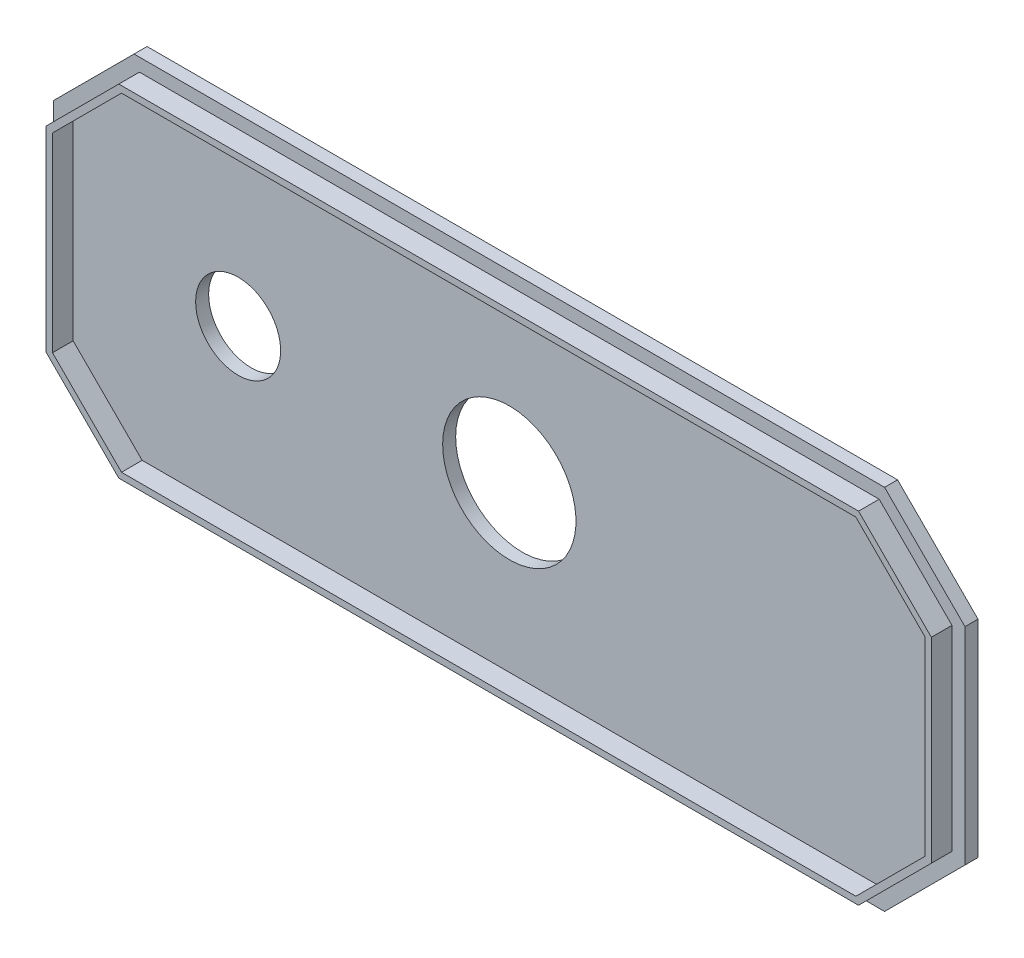
from build123d import *

# Parameters (mm, degrees)
SKETCH1_W           = 56.083
SKETCH1_H           = 22.6058
BOSS_EXTRUDE1_DEPTH = 0.8
CUT_EXTRUDE1_DEPTH  = 31.24435932
BOSS_EXTRUDE2_DEPTH = 1.27
SKETCH4_R           = 2.6162
CUT_EXTRUDE2_DEPTH  = 2.54
SKETCH5_R           = 4.1021
CUT_EXTRUDE3_DEPTH  = 2.54


with BuildPart() as part:
    # Sketch1 → Boss-Extrude1 (new body)
    with BuildSketch(Plane.XY):
        Rectangle(SKETCH1_W, SKETCH1_H)
    extrude(amount=BOSS_EXTRUDE1_DEPTH)

    # Sketch2 → Cut-Extrude1 (cut, through all)
    with BuildSketch(Plane.XY.offset(0.8)):
        Polygon((-28.0415, -6.353152532), (-23.091752532, -11.3029), (-28.0415, -11.3029), align=None)
        Polygon((-28.0415, 6.353152532), (-23.091752532, 11.3029), (-28.0415, 11.3029), align=None)
        Polygon((23.091752532, -11.3029), (28.0415, -6.353152532), (28.0415, -11.3029), align=None)
        Polygon((23.091752532, 11.3029), (28.0415, 6.353152532), (28.0415, 11.3029), align=None)
    extrude(amount=-CUT_EXTRUDE1_DEPTH, mode=Mode.SUBTRACT)

    # Sketch3 → Boss-Extrude2 (add)
    with BuildSketch(Plane.XY.offset(0.8)):
        Polygon((22.760381698, 10.502900038), (-22.760381698, 10.502900038), (-27.241500038, 6.021781698), (-27.241500038, -6.021781698), (-22.760381698, -10.502900038), (22.760381698, -10.502900038), (27.241500038, -6.021781698), (27.241500038, 6.021781698), align=None)
        Polygon((-22.594696288, 10.102900076), (-26.841500076, 5.856096288), (-26.841500076, -5.856096288), (-22.594696288, -10.102900076), (22.594696288, -10.102900076), (26.841500076, -5.856096288), (26.841500076, 5.856096288), (22.594696288, 10.102900076), align=None, mode=Mode.SUBTRACT)
    extrude(amount=BOSS_EXTRUDE2_DEPTH)

    # Sketch4 → Cut-Extrude2 (cut)
    with BuildSketch(Plane(origin=(0, 0, 0), x_dir=(-1, 0, 0), z_dir=(0, 0, -1))):
        with Locations((16.6877, 0)):
            Circle(SKETCH4_R)
    extrude(amount=-CUT_EXTRUDE2_DEPTH, mode=Mode.SUBTRACT)

    # Sketch5 → Cut-Extrude3 (cut)
    with BuildSketch(Plane(origin=(0, 0, 0), x_dir=(-1, 0, 0), z_dir=(0, 0, -1))):
        Circle(SKETCH5_R)
    extrude(amount=-CUT_EXTRUDE3_DEPTH, mode=Mode.SUBTRACT)


solid = part.part
